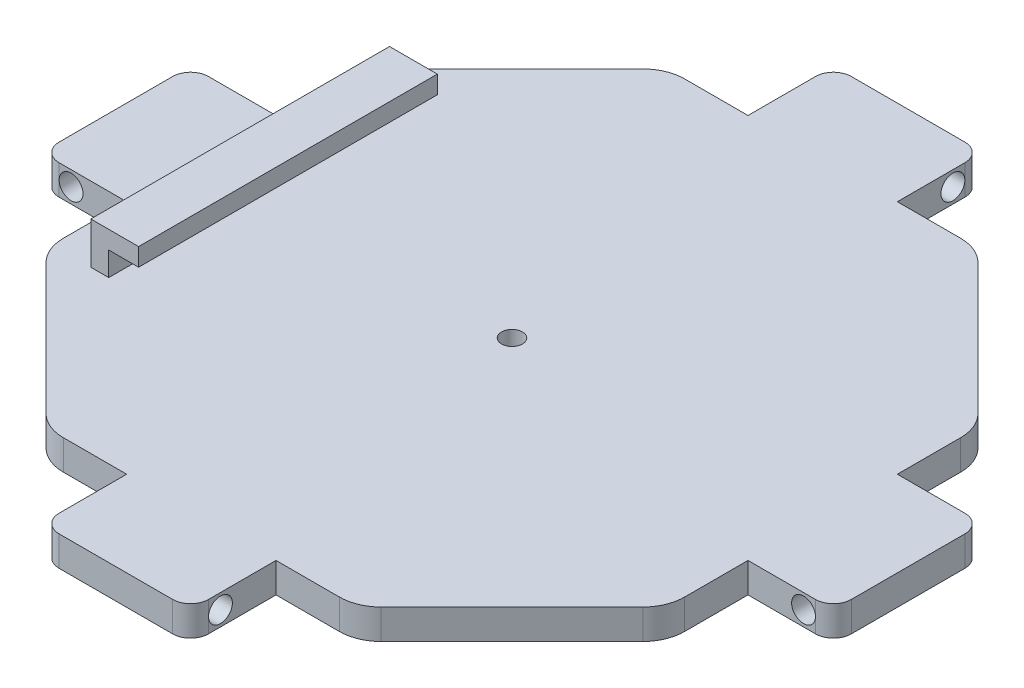
from build123d import *

# Parameters (mm, degrees)
SKETCH_1_W          = 14.3
SKETCH_1_H          = 25
SKETCH_1_W_2        = 25
SKETCH_1_H_2        = 14.3
EXTRUDE_1_DEPTH     = 5
FILLET_1_R          = 3
FILLET_2_R          = 7
FILLET_3_R          = 23
EXTRUDE_START       = -5
EXTRUDE_2_DEPTH     = 5
SKETCH_7_R          = 1.75
CUT_EXTRUDE_5_DEPTH = 94.895580301
SKETCH_9_W          = 3
SKETCH_9_H          = 50
EXTRUDE_3_DEPTH     = 7
SKETCH_10_W         = 50
SKETCH_10_H         = 3
EXTRUDE_4_DEPTH     = 5
SKETCH_11_R         = 2
CUT_EXTRUDE_6_DEPTH = 104.678011169
SKETCH_12_R         = 2
CUT_EXTRUDE_7_DEPTH = 104.678011169


with BuildPart() as part:
    # 스케치1 → 보스-돌출1 (new body)
    with BuildSketch(Plane(origin=(0, 0, 0), x_dir=(1, 0, 0), z_dir=(0, 1, 0))):
        Polygon((-26, 52), (-39, 39), (-26, 39), (26, 39), (39, 39), (26, 52), (12.5, 52), (-12.5, 52), align=None)
        Polygon((-26, 39), (-39, 39), (-39, 26), align=None)
        Polygon((-39, 26), (-39, 39), (-52, 26), (-52, 12.5), (-52, -12.5), (-52, -26), (-39, -39), (-39, -26), align=None)
        with Locations((-59.15, 0)):
            Rectangle(SKETCH_1_W, SKETCH_1_H)
        with Locations((0, 59.15)):
            Rectangle(SKETCH_1_W_2, SKETCH_1_H_2)
        Polygon((39, 39), (26, 39), (39, 26), align=None)
        Polygon((52, 26), (39, 39), (39, 26), (39, -26), (39, -39), (52, -26), (52, -12.5), (52, 12.5), align=None)
        with Locations((59.15, 0)):
            Rectangle(SKETCH_1_W, SKETCH_1_H)
        Polygon((39, -39), (39, -26), (26, -39), align=None)
        Polygon((-26, -39), (-39, -39), (-26, -52), (-12.5, -52), (12.5, -52), (26, -52), (39, -39), (26, -39), align=None)
        Polygon((-26, -39), (-39, -26), (-39, -39), align=None)
        with Locations((0, -59.15)):
            Rectangle(SKETCH_1_W_2, SKETCH_1_H_2)
    extrude(amount=EXTRUDE_1_DEPTH)

    # 필렛1
    fillet_1_edges = [part.edges().sort_by_distance(p)[0] for p in [
        (12.5, 2.5, 66.3),
        (-12.5, 2.5, 66.3),
        (-66.3, 2.5, 12.5),
        (-66.3, 2.5, -12.5),
        (-12.5, 2.5, -66.3),
        (12.5, 2.5, -66.3),
        (66.3, 2.5, -12.5),
        (66.3, 2.5, 12.5),
    ]]
    fillet(fillet_1_edges, radius=FILLET_1_R)

    # 필렛2
    fillet_2_edges = [part.edges().sort_by_distance(p)[0] for p in [
        (-26, 2.5, 52),
        (-52, 2.5, 26),
        (-52, 2.5, -26),
        (-26, 2.5, -52),
        (26, 2.5, -52),
        (52, 2.5, -26),
        (52, 2.5, 26),
        (26, 2.5, 52),
    ]]
    fillet(fillet_2_edges, radius=FILLET_2_R)

    # 필렛3
    # the kernel refuses this fillet: 23 mm, written as the material it adds along each edge
    with BuildSketch(Plane(origin=(-39, 0, 26), x_dir=(0, 0, -1), z_dir=(0, 1, 0))) as fillet_3_piece_1:
        with BuildLine():
            CenterArc((FILLET_3_R * 0.414213562373, -FILLET_3_R), FILLET_3_R, 90, 45)
            Line((-FILLET_3_R * 0.292893218813, -FILLET_3_R * 0.292893218813), (0, 0))
            Line((0, 0), (FILLET_3_R * 0.414213562373, 0))
        make_face()
    extrude(amount=5)
    with BuildSketch(Plane(origin=(-26, 0, 39), x_dir=(1, 0, 0), z_dir=(0, 1, 0)), Plane(origin=(26, 0, 39), x_dir=(0.7071067811865479, 0, -0.7071067811865471), z_dir=(0, 1, 0)), Plane(origin=(39, 0, 26), x_dir=(0, 0, -1), z_dir=(0, 1, 0)), Plane(origin=(39, 0, -26), x_dir=(-0.7071067811865476, 0, -0.7071067811865476), z_dir=(0, 1, 0)), Plane(origin=(26, 0, -39), x_dir=(-1, 0, 0), z_dir=(0, 1, 0)), Plane(origin=(-26, 0, -39), x_dir=(-0.7071067811865471, 0, 0.7071067811865479), z_dir=(0, 1, 0)), Plane(origin=(-39, 0, -26), x_dir=(0, 0, 1), z_dir=(0, 1, 0))) as fillet_3_piece_2:
        with BuildLine():
            CenterArc((FILLET_3_R * 0.414213562373, FILLET_3_R), FILLET_3_R, 225, 45)
            Line((-FILLET_3_R * 0.292893218813, FILLET_3_R * 0.292893218813), (0, 0))
            Line((0, 0), (FILLET_3_R * 0.414213562373, 0))
        make_face()
    extrude(amount=5)

    # 스케치6 → 보스-돌출2 (add)
    with BuildSketch(Plane(origin=(0, 5, 0), x_dir=(1, 0, 0), z_dir=(0, 1, 0)).offset(EXTRUDE_START)):
        with BuildLine():
            Line((16.473088065, 39), (-16.473088065, 39))
            ThreePointArc((-16.473088065, 39), (-25.120040329, 37.312677367), (-32.4982797, 32.4982797))
            ThreePointArc((-32.4982797, 32.4982797), (-37.312677367, 25.120040329), (-39, 16.473088065))
            Line((-39, 16.473088065), (-39, -16.473088065))
            ThreePointArc((-39, -16.473088065), (-37.312677367, -25.120040329), (-32.4982797, -32.4982797))
            ThreePointArc((-32.4982797, -32.4982797), (-25.120040329, -37.312677367), (-16.473088065, -39))
            Line((-16.473088065, -39), (16.473088065, -39))
            ThreePointArc((16.473088065, -39), (25.120040329, -37.312677367), (32.4982797, -32.4982797))
            ThreePointArc((32.4982797, -32.4982797), (37.312677367, -25.120040329), (39, -16.473088065))
            Line((39, -16.473088065), (39, 16.473088065))
            ThreePointArc((39, 16.473088065), (37.312677367, 25.120040329), (32.4982797, 32.4982797))
            ThreePointArc((32.4982797, 32.4982797), (25.120040329, 37.312677367), (16.473088065, 39))
        make_face()
    extrude(amount=EXTRUDE_2_DEPTH)

    # 스케치7 → 컷-돌출5 (cut, through all)
    with BuildSketch(Plane(origin=(0, 5, 0), x_dir=(1, 0, 0), z_dir=(0, 1, 0))):
        with Locations(Location((0, 0, 0), (0, 0, 270))):
            Circle(SKETCH_7_R)
    extrude(amount=-CUT_EXTRUDE_5_DEPTH, mode=Mode.SUBTRACT)

    # 스케치9 → 보스-돌출3 (add)
    with BuildSketch(Plane(origin=(0, 5, 0), x_dir=(1, 0, 0), z_dir=(0, 1, 0))):
        with Locations((-44, 0)):
            Rectangle(SKETCH_9_W, SKETCH_9_H)
    extrude(amount=EXTRUDE_3_DEPTH)

    # 스케치10 → 보스-돌출4 (add)
    with BuildSketch(Plane(origin=(-42.5, 0, 0), x_dir=(0, 0, -1), z_dir=(1, 0, 0))):
        with Locations((0, 10.5)):
            Rectangle(SKETCH_10_W, SKETCH_10_H)
    extrude(amount=EXTRUDE_4_DEPTH)

    # 스케치11 → 컷-돌출6 (cut, through all)
    with BuildSketch(Plane.XY.offset(12.5)):
        with Locations(Location((-61.3, 2.5, 0), (0, 0, 180))):
            Circle(SKETCH_11_R)
        with Locations((61.3, 2.5)):
            Circle(SKETCH_11_R)
    extrude(amount=-CUT_EXTRUDE_6_DEPTH, mode=Mode.SUBTRACT)

    # 스케치12 → 컷-돌출7 (cut, through all)
    with BuildSketch(Plane.ZY.offset(12.5)):
        with Locations(Location((-61.3, 2.5, 0), (0, 0, 180))):
            Circle(SKETCH_12_R)
        with Locations((61.3, 2.5)):
            Circle(SKETCH_12_R)
    extrude(amount=-CUT_EXTRUDE_7_DEPTH, mode=Mode.SUBTRACT)


solid = part.part
